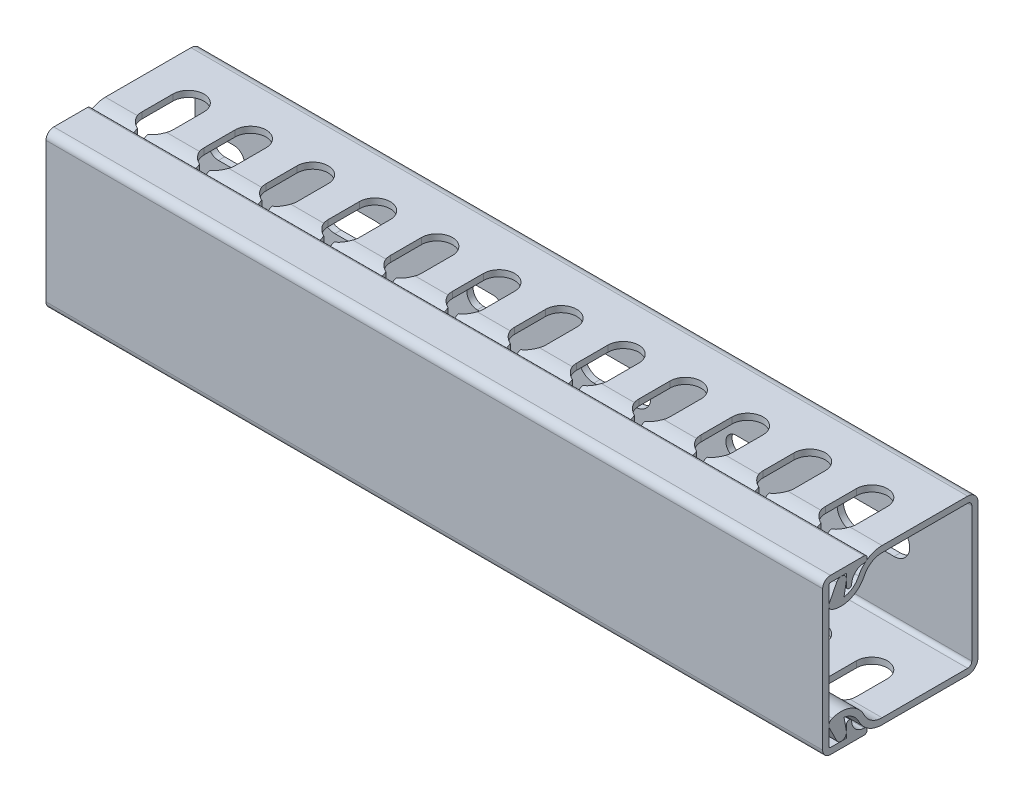
from build123d import *

# Parameters (mm, degrees)
BOSS_EXTRUDE1_DEPTH   = 150
BOSS_EXTRUDE1_2_DEPTH = 150
CUT_EXTRUDE1_DEPTH    = 154.704261489
CUT_EXTRUDE3_DEPTH    = 154.704261597
LPATTERN1_COUNT       = 12
LPATTERN1_PITCH       = 12
LPATTERN2_COUNT       = 3
LPATTERN2_PITCH       = 50
FILLET1_R             = 1.5
FILLET2_R             = 2
FILLET3_R             = 0.8
FILLET4_R             = 0.3


with BuildPart() as part:
    # Sketch1 → Boss-Extrude1 (new body)
    with BuildSketch(Plane(origin=(0, 0, 0), x_dir=(0, 0, -1), z_dir=(1, 0, 0))):
        with BuildLine():
            ThreePointArc((-25.4, -12.8), (-25.403805302, -12.712844257), (-25.415192247, -12.626351822))
            Line((-25.415192247, -12.626351822), (-25.86978878, -10.04820677))
            ThreePointArc((-25.86978878, -10.04820677), (-24.198108683, -10.756289031), (-23.045701756, -12.159090909))
            ThreePointArc((-23.045701756, -12.159090909), (-22.438874408, -13.125184501), (-21.628846223, -13.928571454))
            ThreePointArc((-21.628846223, -13.928571454), (-20.172532542, -14.724555919), (-18.535898385, -15))
            Line((-18.535898385, -15), (0, -15))
            Line((0, -15), (0, 15))
            Line((0, 15), (-18.535898385, 15))
            ThreePointArc((-18.535898385, 15), (-20.172532542, 14.724555919), (-21.628846223, 13.928571454))
            ThreePointArc((-21.628846223, 13.928571454), (-22.438874408, 13.125184501), (-23.045701756, 12.159090909))
            ThreePointArc((-23.045701756, 12.159090909), (-24.198108683, 10.756289031), (-25.86978878, 10.04820677))
            Line((-25.86978878, 10.04820677), (-25.415192247, 12.626351822))
            ThreePointArc((-25.415192247, 12.626351822), (-25.403805302, 12.712844257), (-25.4, 12.8))
            ThreePointArc((-25.4, 12.8), (-25.692893219, 13.507106781), (-26.4, 13.8))
            ThreePointArc((-26.4, 13.8), (-26.924109136, 13.65165111), (-27.292716255, 13.250619228))
            Line((-27.292716255, 13.250619228), (-28.692716255, 10.477096308))
            ThreePointArc((-28.692716255, 10.477096308), (-28.772809399, 10.258084231), (-28.8, 10.02647708))
            ThreePointArc((-28.8, 10.02647708), (-28.615999976, 9.448425145), (-28.13171192, 9.08309635))
            ThreePointArc((-28.13171192, 9.08309635), (-24.557950172, 9.181342106), (-21.963348947, 11.640909091))
            ThreePointArc((-21.963348947, 11.640909091), (-20.56130519, 13.215233626), (-18.535898385, 13.8))
            Line((-18.535898385, 13.8), (-1.2, 13.8))
            Line((-1.2, 13.8), (-1.2, -13.8))
            Line((-1.2, -13.8), (-18.535898385, -13.8))
            ThreePointArc((-18.535898385, -13.8), (-20.56130519, -13.215233626), (-21.963348947, -11.640909091))
            ThreePointArc((-21.963348947, -11.640909091), (-24.557950172, -9.181342106), (-28.13171192, -9.08309635))
            ThreePointArc((-28.13171192, -9.08309635), (-28.615999976, -9.448425145), (-28.8, -10.02647708))
            ThreePointArc((-28.8, -10.02647708), (-28.772809399, -10.258084231), (-28.692716255, -10.477096308))
            Line((-28.692716255, -10.477096308), (-27.292716255, -13.250619228))
            ThreePointArc((-27.292716255, -13.250619228), (-26.924109136, -13.65165111), (-26.4, -13.8))
            ThreePointArc((-26.4, -13.8), (-25.692893219, -13.507106781), (-25.4, -12.8))
        make_face()
    extrude(amount=BOSS_EXTRUDE1_DEPTH)

    # Sketch2 → Cut-Extrude1 (cut, symmetric)
    with BuildSketch(Plane(origin=(0, 0, 0), x_dir=(1, 0, 0), z_dir=(0, 1, 0))):
        with BuildLine():
            Line((12, -11.5), (12, -17.5))
            ThreePointArc((12, -17.5), (11.449489743, -19.232050808), (10, -20.328427125))
            Line((10, -20.328427125), (10, -30.388039055))
            Line((10, -30.388039055), (8, -30.388039055))
            Line((8, -30.388039055), (8, -20.328427125))
            ThreePointArc((8, -20.328427125), (6.550510257, -19.232050808), (6, -17.5))
            Line((6, -17.5), (6, -11.5))
            ThreePointArc((6, -11.5), (9, -8.5), (12, -11.5))
        make_face()
    cut_extrude1 = extrude(amount=CUT_EXTRUDE1_DEPTH, both=True, mode=Mode.SUBTRACT)

    # Sketch4 → Cut-Extrude3 (cut, through all)
    with BuildSketch(Plane.XY):
        with BuildLine():
            Line((4.5, 2), (7.5, 2))
            ThreePointArc((7.5, 2), (9.5, 0), (7.5, -2))
            Line((7.5, -2), (4.5, -2))
            ThreePointArc((4.5, -2), (2.5, 0), (4.5, 2))
        make_face()
        with BuildLine():
            Line((27, 3), (35, 3))
            ThreePointArc((35, 3), (38, 0), (35, -3))
            Line((35, -3), (27, -3))
            ThreePointArc((27, -3), (24, 0), (27, 3))
        make_face()
    cut_extrude3 = extrude(amount=CUT_EXTRUDE3_DEPTH, mode=Mode.SUBTRACT)

    # LPattern1: Cut-Extrude1 ×12
    with Locations(*[(i * LPATTERN1_PITCH, 0, 0) for i in range(1, LPATTERN1_COUNT)]):
        add(cut_extrude1, mode=Mode.SUBTRACT)

    # LPattern2: Cut-Extrude3 ×3
    with Locations(*[(i * LPATTERN2_PITCH, 0, 0) for i in range(1, LPATTERN2_COUNT)]):
        add(cut_extrude3, mode=Mode.SUBTRACT)

    # Fillet2
    fillet2_edges = [part.edges().sort_by_distance(p)[0] for p in [
        (75, -15, 0),
        (75, 15, 0),
    ]]
    fillet(fillet2_edges, radius=FILLET2_R)

    # Fillet3
    fillet3_edges = [part.edges().sort_by_distance(p)[0] for p in [
        (75, -13.8, 1.2),
        (75, 13.8, 1.2),
    ]]
    fillet(fillet3_edges, radius=FILLET3_R)


with BuildPart() as body_2:
    # Sketch1 → Boss-Extrude1 2 (new body)
    with BuildSketch(Plane(origin=(0, 0, 0), x_dir=(0, 0, -1), z_dir=(1, 0, 0))):
        with BuildLine():
            Line((-25.4, -11.5), (-25.4, -12.8))
            Line((-25.4, -12.8), (-25.4, -13.8))
            Line((-25.4, -13.8), (-26.4, -13.8))
            Line((-26.4, -13.8), (-28.8, -13.8))
            Line((-28.8, -13.8), (-28.8, -10.02647708))
            Line((-28.8, -10.02647708), (-28.8, 10.02647708))
            Line((-28.8, 10.02647708), (-28.8, 13.8))
            Line((-28.8, 13.8), (-26.4, 13.8))
            Line((-26.4, 13.8), (-25.4, 13.8))
            Line((-25.4, 13.8), (-25.4, 12.8))
            Line((-25.4, 12.8), (-25.4, 11.5))
            ThreePointArc((-25.4, 11.5), (-24.90877058, 11.000076929), (-24.400307692, 11.482461538))
            ThreePointArc((-24.400307692, 11.482461538), (-23.66826718, 13.126062437), (-22, 13.8))
            ThreePointArc((-22, 13.8), (-21.803603879, 13.833053297), (-21.628846223, 13.928571454))
            ThreePointArc((-21.628846223, 13.928571454), (-21.433053297, 14.596396121), (-22, 15))
            Line((-22, 15), (-30, 15))
            Line((-30, 15), (-30, -15))
            Line((-30, -15), (-22, -15))
            ThreePointArc((-22, -15), (-21.433053297, -14.596396121), (-21.628846223, -13.928571454))
            ThreePointArc((-21.628846223, -13.928571454), (-21.803603879, -13.833053297), (-22, -13.8))
            ThreePointArc((-22, -13.8), (-23.66826718, -13.126062437), (-24.400307692, -11.482461538))
            ThreePointArc((-24.400307692, -11.482461538), (-24.90877058, -11.000076929), (-25.4, -11.5))
        make_face()
    extrude(amount=BOSS_EXTRUDE1_2_DEPTH)

    # Fillet1
    fillet1_edges = [body_2.edges().sort_by_distance(p)[0] for p in [
        (75, -15, 30),
        (75, 15, 30),
    ]]
    fillet(fillet1_edges, radius=FILLET1_R)

    # Fillet4
    fillet4_edges = [body_2.edges().sort_by_distance(p)[0] for p in [
        (75, -13.8, 28.8),
        (75, 13.8, 28.8),
    ]]
    fillet(fillet4_edges, radius=FILLET4_R)


solid = Compound([part.part, body_2.part])
